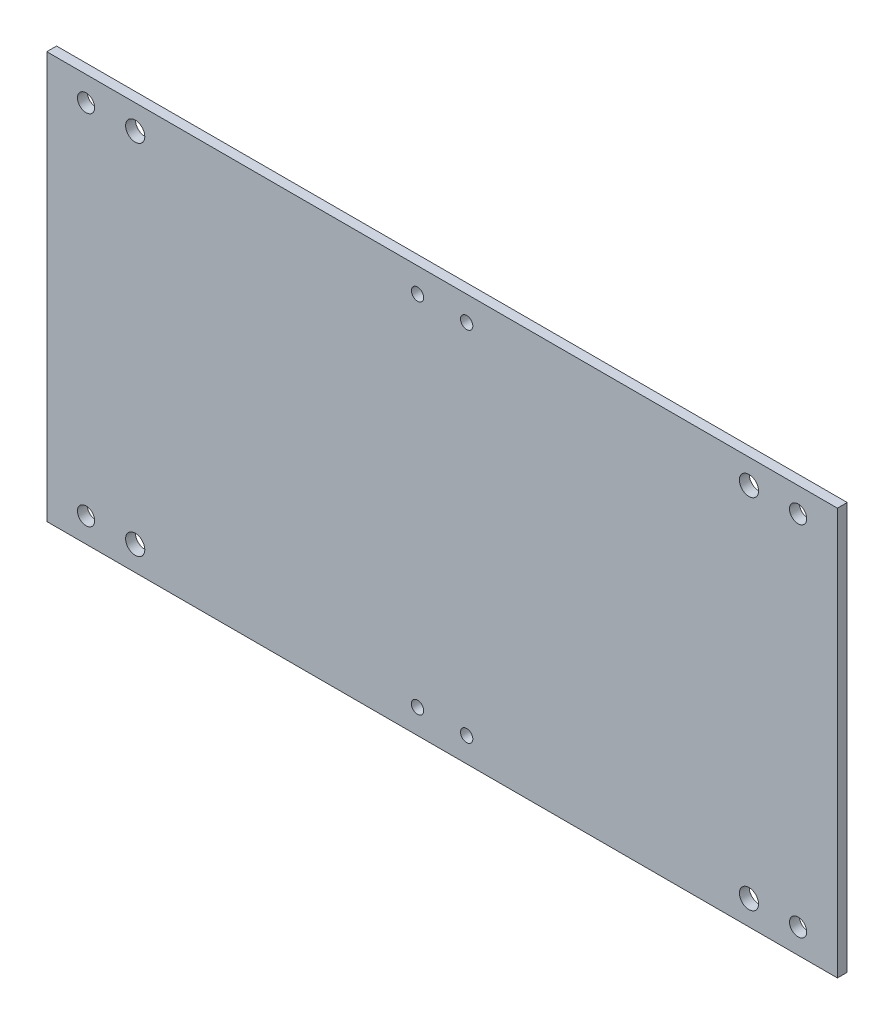
from build123d import *

# Parameters (mm, degrees)
SKETCH1_W           = 321.81
SKETCH1_H           = 165.61
BOSS_EXTRUDE1_DEPTH = 4
SKETCH3_R           = 3.5
CUT_EXTRUDE1_DEPTH  = 868.779774201
SKETCH4_R           = 3.9
CUT_EXTRUDE2_DEPTH  = 10
SKETCH5_R           = 2.5
CUT_EXTRUDE4_DEPTH  = 10


with BuildPart() as part:
    # Sketch1 → Boss-Extrude1 (new body)
    with BuildSketch(Plane.XY):
        with Locations((591.992540984, 348.670409836)):
            Rectangle(SKETCH1_W, SKETCH1_H)
    extrude(amount=BOSS_EXTRUDE1_DEPTH)

    # Sketch3 → Cut-Extrude1 (cut, through all)
    with BuildSketch(Plane.XY.offset(4)):
        with Locations((447.087540984, 421.475409836)):
            Circle(SKETCH3_R)
        with Locations((736.897540984, 421.475409836)):
            Circle(SKETCH3_R)
        with Locations((736.897540984, 275.865409836)):
            Circle(SKETCH3_R)
        with Locations((447.087540984, 275.865409836)):
            Circle(SKETCH3_R)
    extrude(amount=-CUT_EXTRUDE1_DEPTH, mode=Mode.SUBTRACT)

    # Sketch4 → Cut-Extrude2 (cut)
    with BuildSketch(Plane.XY.offset(4)):
        with Locations((467.087540984, 421.475409836)):
            Circle(SKETCH4_R)
        with Locations((716.897540984, 421.475409836)):
            Circle(SKETCH4_R)
        with Locations((716.897540984, 275.865409836)):
            Circle(SKETCH4_R)
        with Locations((467.087540984, 275.865409836)):
            Circle(SKETCH4_R)
    extrude(amount=-CUT_EXTRUDE2_DEPTH, mode=Mode.SUBTRACT)

    # Sketch5 → Cut-Extrude4 (cut)
    with BuildSketch(Plane.XY.offset(4)):
        with Locations((581.992540984, 421.475409836)):
            Circle(SKETCH5_R)
        with Locations((601.992540984, 421.475409836)):
            Circle(SKETCH5_R)
        with Locations((581.992540984, 275.865409836)):
            Circle(SKETCH5_R)
        with Locations((601.992540984, 275.865409836)):
            Circle(SKETCH5_R)
    extrude(amount=-CUT_EXTRUDE4_DEPTH, mode=Mode.SUBTRACT)


solid = part.part
